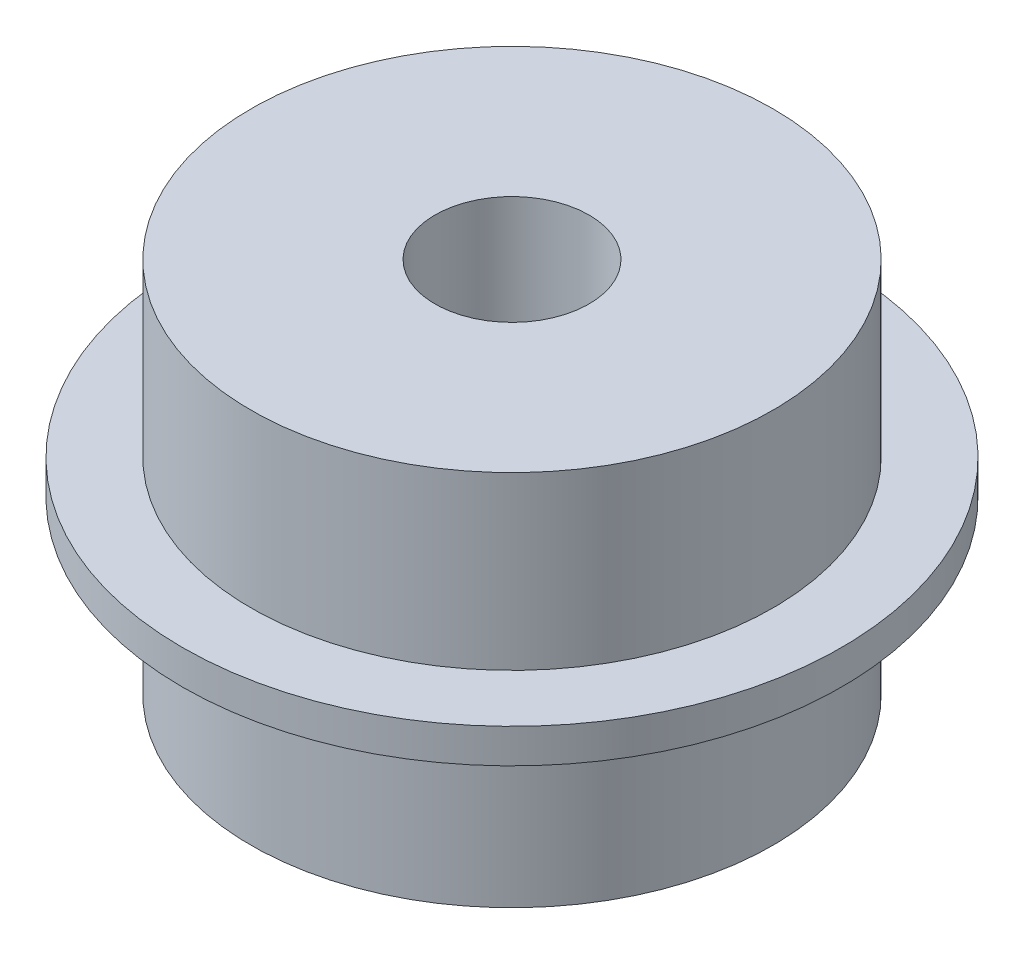
from build123d import *


with BuildPart() as part:
    # Sketch1 → Revolve1 (revolve)
    with BuildSketch(Plane.XY):
        Polygon((-2.25, -5.5), (-2.25, 5.5), (-7.62, 5.5), (-7.62, 0.5), (-9.62, 0.5), (-9.62, -0.5), (-7.62, -0.5), (-7.62, -5.5), align=None)
    revolve(axis=Axis((0, 0, 0), (0, 1, 0)))


solid = part.part
